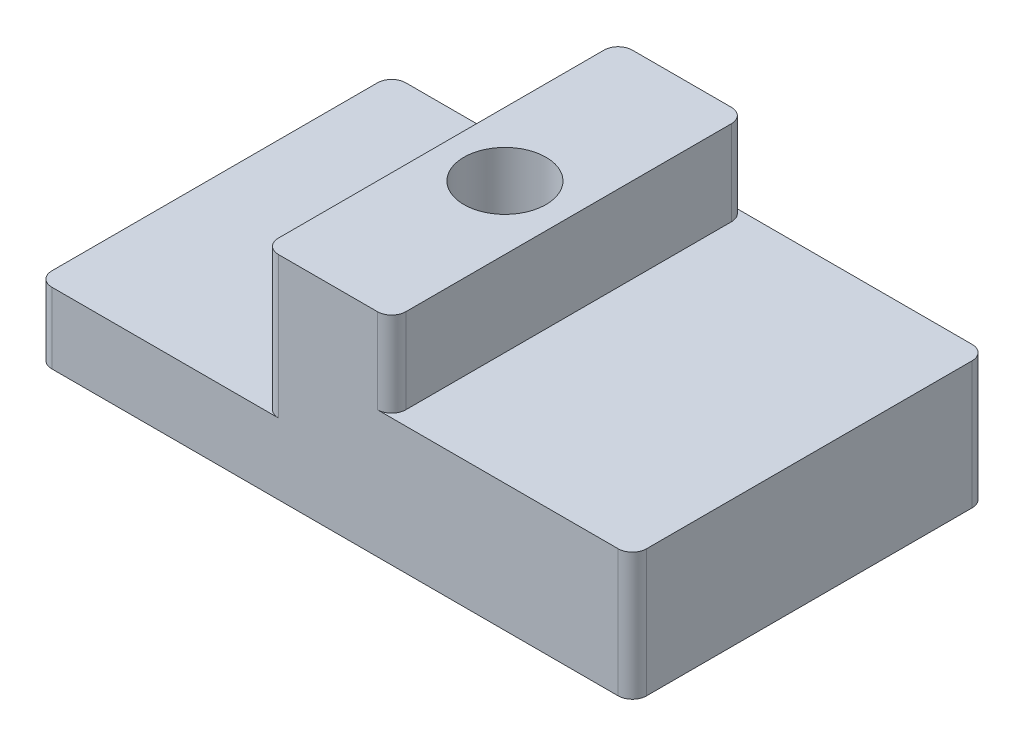
from build123d import *

# Parameters (mm, degrees)
SKETCH1_W            = 45
SKETCH1_H            = 25
BOSS_EXTRUDE1_DEPTH  = 5
SKETCH5_W            = 26
SKETCH5_H            = 25
BOSS_EXTRUDE3_DEPTH  = 4
SKETCH11_W           = 9
SKETCH11_H           = 25
BOSS_EXTRUDE5_DEPTH  = 6
SKETCH12_W           = 3
SKETCH12_H           = 25
CUT_EXTRUDE2_DEPTH   = 53.440442409
M5_CLEARANCE_HOLE1_D = 5.8
FILLET2_R            = 1


with BuildPart() as part:
    # Sketch1 → Boss-Extrude1 (new body)
    with BuildSketch(Plane(origin=(0, 0, 0), x_dir=(1, 0, 0), z_dir=(0, 1, 0))):
        with Locations((22.5, 12.5)):
            Rectangle(SKETCH1_W, SKETCH1_H)
    extrude(amount=BOSS_EXTRUDE1_DEPTH)

    # Sketch5 → Boss-Extrude3 (add)
    with BuildSketch(Plane(origin=(0, 5, 0), x_dir=(1, 0, 0), z_dir=(0, 1, 0))):
        with Locations((32, 12.5)):
            Rectangle(SKETCH5_W, SKETCH5_H)
    extrude(amount=BOSS_EXTRUDE3_DEPTH)

    # Sketch11 → Boss-Extrude5 (add)
    with BuildSketch(Plane(origin=(0, 9, 0), x_dir=(1, 0, 0), z_dir=(0, 1, 0))):
        with Locations((23.5, 12.5)):
            Rectangle(SKETCH11_W, SKETCH11_H)
    extrude(amount=BOSS_EXTRUDE5_DEPTH)

    # Sketch12 → Cut-Extrude2 (cut, through all)
    with BuildSketch(Plane(origin=(0, 5, 0), x_dir=(1, 0, 0), z_dir=(0, 1, 0))):
        with Locations((1.5, 12.5)):
            Rectangle(SKETCH12_W, SKETCH12_H)
    extrude(amount=-CUT_EXTRUDE2_DEPTH, mode=Mode.SUBTRACT)

    # M5 Clearance Hole1 (through all)
    with Locations(Plane(origin=(0, 0, 0), x_dir=(-1, 0, 0), z_dir=(0, -1, 0))):
        with Locations((-23.5, 12.5)):
            Hole(M5_CLEARANCE_HOLE1_D / 2)

    # Fillet2
    fillet2_edges = [part.edges().sort_by_distance(p)[0] for p in [
        (28, 12, 0),
        (19, 10, 0),
        (19, 10, -25),
        (28, 12, -25),
        (3, 2.5, -25),
        (3, 2.5, 0),
        (45, 4.5, 0),
        (45, 4.5, -25),
    ]]
    fillet(fillet2_edges, radius=FILLET2_R)


solid = part.part
